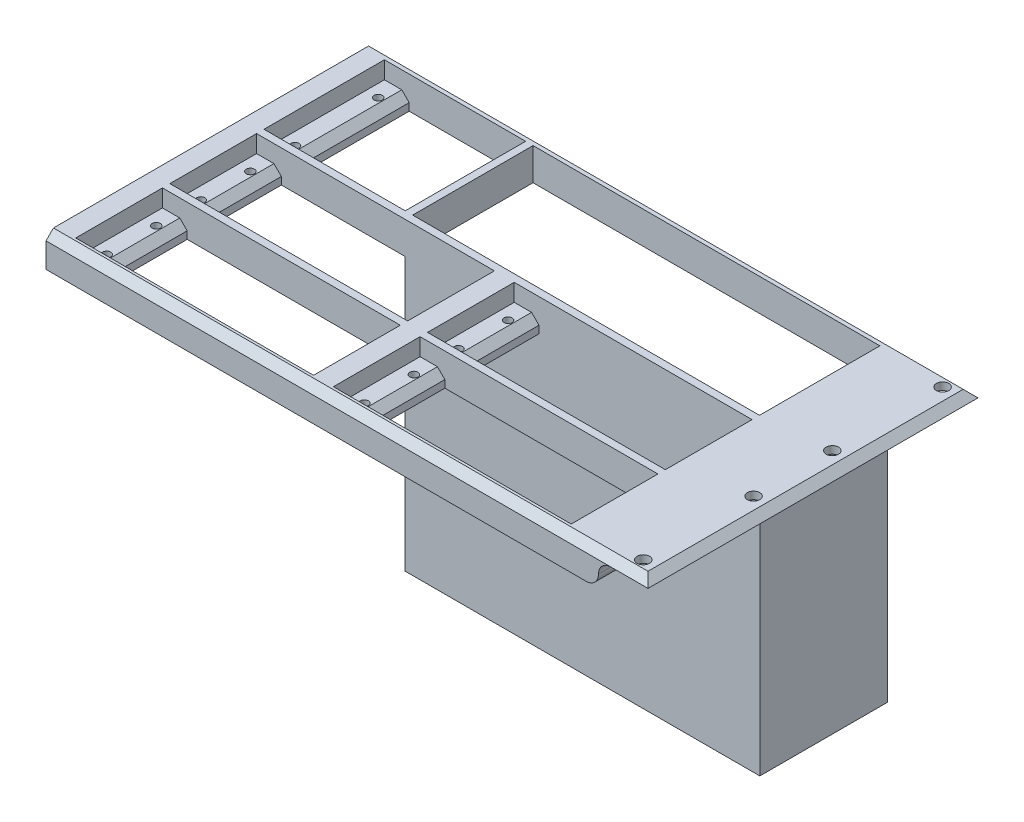
from build123d import *

# Parameters (mm, degrees)
SKETCH1_W                      = 243
SKETCH1_H                      = 133.2
BOSS_EXTRUDE1_DEPTH            = 13
SKETCH32_W                     = 20
SKETCH32_H                     = 133.2
CUT_EXTRUDE10_DEPTH            = 10
FILLET1_START                  = -68
FILLET1_DEPTH                  = 136
FILLET1_START_2                = -66.6
FILLET1_2_DEPTH                = 133.2
M6X1_0_TAPPED_HOLE1_D          = 5
M6X1_0_TAPPED_HOLE1_DEPTH      = 15
M6X1_0_TAPPED_HOLE1_TIP        = 1.502151548
SKETCH36_W                     = 96
SKETCH36_H                     = 35
CUT_EXTRUDE11_DEPTH            = 7
SKETCH37_W                     = 76
SKETCH37_H                     = 35
CUT_EXTRUDE12_DEPTH            = 147.644331633
M4X0_7_TAPPED_HOLE1_AT_2_COUNT = 2
M4X0_7_TAPPED_HOLE1_AT_2_PITCH = 20
M4X0_7_TAPPED_HOLE1_AT_3_COUNT = 2
M4X0_7_TAPPED_HOLE1_AT_3_PITCH = 86
M4X0_7_TAPPED_HOLE1_AT_4_COUNT = 2
M4X0_7_TAPPED_HOLE1_AT_4_PITCH = 88.294960219
LPATTERN1_COUNT                = 2
LPATTERN1_PITCH                = 38
LPATTERN1_COUNT_DIR2           = 2
LPATTERN1_PITCH_DIR2           = 104
CHAMFER1_SIZE                  = 3
SKETCH41_W                     = 140
SKETCH41_H                     = 48.6
CUT_EXTRUDE13_DEPTH            = 30
BOSS_EXTRUDE2_DEPTH            = 110
SKETCH43_W                     = 57
SKETCH43_H                     = 48.6
CUT_EXTRUDE14_DEPTH            = 7
SKETCH44_W                     = 37
SKETCH44_H                     = 48.6
CUT_EXTRUDE15_DEPTH            = 17
CHAMFER2_SIZE                  = 3
M4X0_7_TAPPED_HOLE2_D          = 3.3
M4X0_7_TAPPED_HOLE2_DEPTH      = 10.1
M4X0_7_TAPPED_HOLE2_TIP        = 0.991420021


with BuildPart() as part:
    # Sketch1 → Boss-Extrude1 (new body)
    with BuildSketch(Plane(origin=(0, 0, 0), x_dir=(1, 0, 0), z_dir=(0, 1, 0))):
        with Locations((8.5, 0)):
            Rectangle(SKETCH1_W, SKETCH1_H)
    extrude(amount=BOSS_EXTRUDE1_DEPTH)

    # Sketch32 → Cut-Extrude10 (cut)
    with BuildSketch(Plane.XZ):
        with Locations((120, 0)):
            Rectangle(SKETCH32_W, SKETCH32_H)
    extrude(amount=-CUT_EXTRUDE10_DEPTH, mode=Mode.SUBTRACT)

    # Fillet1: read off the stored shape, not the designer's step
    # Fillet1 outline → Fillet1 (cut)
    with BuildSketch(Plane.XY.offset(FILLET1_START)):
        with BuildLine():
            Line((110, 0), (110, 5))
            ThreePointArc((110, 5), (108.535533906, 1.464466094), (105, 0))
            Line((105, 0), (110, 0))
        make_face()
    extrude(amount=FILLET1_DEPTH, mode=Mode.SUBTRACT)

    # Fillet1 2 outline → Fillet1 2 (add)
    with BuildSketch(Plane.XY.offset(FILLET1_START_2)):
        with BuildLine():
            ThreePointArc((110, 5), (111.464466094, 8.535533906), (115, 10))
            Line((115, 10), (110, 10))
            Line((110, 10), (110, 5))
        make_face()
    extrude(amount=FILLET1_2_DEPTH)

    # M6x1.0 Tapped Hole1
    with Locations(Plane(origin=(0, 13, 0), x_dir=(1, 0, 0), z_dir=(0, 1, 0))):
        with Locations((122.05, 60.25), (122.05, 15.75), (122.05, -16.05), (122.05, -60.55)):
            Hole(M6X1_0_TAPPED_HOLE1_D / 2, depth=M6X1_0_TAPPED_HOLE1_DEPTH)
            with Locations((0, 0, -(M6X1_0_TAPPED_HOLE1_DEPTH + M6X1_0_TAPPED_HOLE1_TIP / 2))):  # 118° drill point
                Cone(0, M6X1_0_TAPPED_HOLE1_D / 2, M6X1_0_TAPPED_HOLE1_TIP, mode=Mode.SUBTRACT)

    # Sketch36 → Cut-Extrude11 (cut)
    with BuildSketch(Plane(origin=(0, 13, 0), x_dir=(1, 0, 0), z_dir=(0, 1, 0))):
        with Locations((-57, -45.1)):
            Rectangle(SKETCH36_W, SKETCH36_H)
        with Locations((-57, -7.1)):
            Rectangle(SKETCH36_W, SKETCH36_H)
        with Locations((47, -7.1)):
            Rectangle(SKETCH36_W, SKETCH36_H)
        with Locations((47, -45.1)):
            Rectangle(SKETCH36_W, SKETCH36_H)
    extrude(amount=-CUT_EXTRUDE11_DEPTH, mode=Mode.SUBTRACT)

    # Sketch37 → Cut-Extrude12 (cut, through all)
    with BuildSketch(Plane(origin=(0, 13, 0), x_dir=(1, 0, 0), z_dir=(0, 1, 0))):
        with Locations((-57, -45.1)):
            Rectangle(SKETCH37_W, SKETCH37_H)
        with Locations((-57, -7.1)):
            Rectangle(SKETCH37_W, SKETCH37_H)
        with Locations((47, -7.1)):
            Rectangle(SKETCH37_W, SKETCH37_H)
        with Locations((47, -45.1)):
            Rectangle(SKETCH37_W, SKETCH37_H)
    extrude(amount=-CUT_EXTRUDE12_DEPTH, mode=Mode.SUBTRACT)

    # Sketch39 → M4x0.7 Tapped Hole1 (revolve, cut)
    with BuildSketch(Plane(origin=(-100, 6, 55.1), x_dir=(0, 0, 1), z_dir=(1, 0, 0))):
        Polygon((0, 0), (0, 11.091420021), (1.65, 10.1), (1.65, 0), align=None)
    m4x0_7_tapped_hole1 = revolve(axis=Axis((-100, 12.35, 55.1), (0, -1, 0)), mode=Mode.SUBTRACT)

    # M4x0.7 Tapped Hole1 at 2: M4x0.7 Tapped Hole1 ×2
    with Locations(*[(0, 0, -i * M4X0_7_TAPPED_HOLE1_AT_2_PITCH) for i in range(1, M4X0_7_TAPPED_HOLE1_AT_2_COUNT)]):
        add(m4x0_7_tapped_hole1, mode=Mode.SUBTRACT)

    # M4x0.7 Tapped Hole1 at 3: M4x0.7 Tapped Hole1 ×2
    with Locations(*[(i * M4X0_7_TAPPED_HOLE1_AT_3_PITCH, 0, 0) for i in range(1, M4X0_7_TAPPED_HOLE1_AT_3_COUNT)]):
        add(m4x0_7_tapped_hole1, mode=Mode.SUBTRACT)

    # M4x0.7 Tapped Hole1 at 4: M4x0.7 Tapped Hole1 ×2
    with Locations(*[Vector(0.9740080270391964, 0, -0.2265134946602783) * (i * M4X0_7_TAPPED_HOLE1_AT_4_PITCH) for i in range(1, M4X0_7_TAPPED_HOLE1_AT_4_COUNT)]):
        add(m4x0_7_tapped_hole1, mode=Mode.SUBTRACT)

    # LPattern1: M4x0.7 Tapped Hole1 2 × 2
    with Locations(*[(j * LPATTERN1_PITCH_DIR2, 0, -i * LPATTERN1_PITCH) for i in range(LPATTERN1_COUNT) for j in range(LPATTERN1_COUNT_DIR2) if (i, j) != (0, 0)]):
        add(m4x0_7_tapped_hole1, mode=Mode.SUBTRACT)

    # LPattern1 copy 1 sketch → LPattern1 copy 1 (revolve, cut)
    with BuildSketch(Plane(origin=(4, 6, 35.1), x_dir=(0, 0, 1), z_dir=(1, 0, 0))):
        Polygon((0, 0), (0, 11.091420021), (1.65, 10.1), (1.65, 0), align=None)
    revolve(axis=Axis((4, 12.35, 35.1), (0, -1, 0)), mode=Mode.SUBTRACT)

    # LPattern1 copy 2 sketch → LPattern1 copy 2 (revolve, cut)
    with BuildSketch(Plane(origin=(-100, 6, -2.9), x_dir=(0, 0, 1), z_dir=(1, 0, 0))):
        Polygon((0, 0), (0, 11.091420021), (1.65, 10.1), (1.65, 0), align=None)
    revolve(axis=Axis((-100, 12.35, -2.9), (0, -1, 0)), mode=Mode.SUBTRACT)

    # LPattern1 copy 3 sketch → LPattern1 copy 3 (revolve, cut)
    with BuildSketch(Plane(origin=(4, 6, -2.9), x_dir=(0, 0, 1), z_dir=(1, 0, 0))):
        Polygon((0, 0), (0, 11.091420021), (1.65, 10.1), (1.65, 0), align=None)
    revolve(axis=Axis((4, 12.35, -2.9), (0, -1, 0)), mode=Mode.SUBTRACT)

    # LPattern1 copy 4 sketch → LPattern1 copy 4 (revolve, cut)
    with BuildSketch(Plane(origin=(90, 6, 55.1), x_dir=(0, 0, 1), z_dir=(1, 0, 0))):
        Polygon((0, 0), (0, 11.091420021), (1.65, 10.1), (1.65, 0), align=None)
    revolve(axis=Axis((90, 12.35, 55.1), (0, -1, 0)), mode=Mode.SUBTRACT)

    # LPattern1 copy 5 sketch → LPattern1 copy 5 (revolve, cut)
    with BuildSketch(Plane(origin=(-14, 6, 17.1), x_dir=(0, 0, 1), z_dir=(1, 0, 0))):
        Polygon((0, 0), (0, 11.091420021), (1.65, 10.1), (1.65, 0), align=None)
    revolve(axis=Axis((-14, 12.35, 17.1), (0, -1, 0)), mode=Mode.SUBTRACT)

    # LPattern1 copy 6 sketch → LPattern1 copy 6 (revolve, cut)
    with BuildSketch(Plane(origin=(90, 6, 17.1), x_dir=(0, 0, 1), z_dir=(1, 0, 0))):
        Polygon((0, 0), (0, 11.091420021), (1.65, 10.1), (1.65, 0), align=None)
    revolve(axis=Axis((90, 12.35, 17.1), (0, -1, 0)), mode=Mode.SUBTRACT)

    # LPattern1 copy 7 sketch → LPattern1 copy 7 (revolve, cut)
    with BuildSketch(Plane(origin=(90, 6, 35.1), x_dir=(0, 0, 1), z_dir=(1, 0, 0))):
        Polygon((0, 0), (0, 11.091420021), (1.65, 10.1), (1.65, 0), align=None)
    revolve(axis=Axis((90, 12.35, 35.1), (0, -1, 0)), mode=Mode.SUBTRACT)

    # LPattern1 copy 8 sketch → LPattern1 copy 8 (revolve, cut)
    with BuildSketch(Plane(origin=(-14, 6, -2.9), x_dir=(0, 0, 1), z_dir=(1, 0, 0))):
        Polygon((0, 0), (0, 11.091420021), (1.65, 10.1), (1.65, 0), align=None)
    revolve(axis=Axis((-14, 12.35, -2.9), (0, -1, 0)), mode=Mode.SUBTRACT)

    # LPattern1 copy 9 sketch → LPattern1 copy 9 (revolve, cut)
    with BuildSketch(Plane(origin=(90, 6, -2.9), x_dir=(0, 0, 1), z_dir=(1, 0, 0))):
        Polygon((0, 0), (0, 11.091420021), (1.65, 10.1), (1.65, 0), align=None)
    revolve(axis=Axis((90, 12.35, -2.9), (0, -1, 0)), mode=Mode.SUBTRACT)

    # Chamfer1
    chamfer1_edges = [part.edges().sort_by_distance(p)[0] for p in [
        (-95, 6, 7.1),
        (-19, 6, 7.1),
        (-19, 6, 45.1),
        (-95, 6, 45.1),
        (85, 6, 7.1),
        (9, 6, 7.1),
        (9, 6, 45.1),
        (85, 6, 45.1),
        (8.5, 13, -66.6),
        (130, 13, 0),
        (8.5, 13, 66.6),
    ]]
    chamfer(chamfer1_edges, length=CHAMFER1_SIZE - 0.0001)  # a hair under: the kernel refuses the full size

    # Sketch41 → Cut-Extrude13 (cut)
    with BuildSketch(Plane(origin=(0, 13, 0), x_dir=(1, 0, 0), z_dir=(0, 1, 0))):
        with Locations((25, 37.7)):
            Rectangle(SKETCH41_W, SKETCH41_H)
    extrude(amount=-CUT_EXTRUDE13_DEPTH, mode=Mode.SUBTRACT)

    # Sketch42 → Boss-Extrude2 (add)
    with BuildSketch(Plane.XZ):
        Polygon((-45, -13.4), (95, -13.4), (95, -62), (98.143065291, -62), (98.143065291, -10.4), (95, -10.4), (-45, -10.4), align=None)
    extrude(amount=BOSS_EXTRUDE2_DEPTH)

    # Sketch43 → Cut-Extrude14 (cut)
    with BuildSketch(Plane(origin=(0, 13, 0), x_dir=(1, 0, 0), z_dir=(0, 1, 0))):
        with Locations((-76.5, 37.7)):
            Rectangle(SKETCH43_W, SKETCH43_H)
    extrude(amount=-CUT_EXTRUDE14_DEPTH, mode=Mode.SUBTRACT)

    # Sketch44 → Cut-Extrude15 (cut)
    with BuildSketch(Plane(origin=(0, 6, 0), x_dir=(1, 0, 0), z_dir=(0, 1, 0))):
        with Locations((-76.5, 37.7)):
            Rectangle(SKETCH44_W, SKETCH44_H)
    extrude(amount=-CUT_EXTRUDE15_DEPTH, mode=Mode.SUBTRACT)

    # Chamfer2
    chamfer2_edges = [part.edges().sort_by_distance(p)[0] for p in [
        (-95, 6, -37.7),
        (-58, 6, -37.7),
    ]]
    chamfer(chamfer2_edges, length=CHAMFER2_SIZE)

    # M4x0.7 Tapped Hole2
    with Locations(Plane(origin=(0, 6, 0), x_dir=(1, 0, 0), z_dir=(0, 1, 0))):
        with Locations((-100, 20.9), (-100, 54.5), (-53, 54.5), (-53, 20.9)):
            Hole(M4X0_7_TAPPED_HOLE2_D / 2, depth=M4X0_7_TAPPED_HOLE2_DEPTH)
            with Locations((0, 0, -(M4X0_7_TAPPED_HOLE2_DEPTH + M4X0_7_TAPPED_HOLE2_TIP / 2))):  # 118° drill point
                Cone(0, M4X0_7_TAPPED_HOLE2_D / 2, M4X0_7_TAPPED_HOLE2_TIP, mode=Mode.SUBTRACT)


solid = part.part
